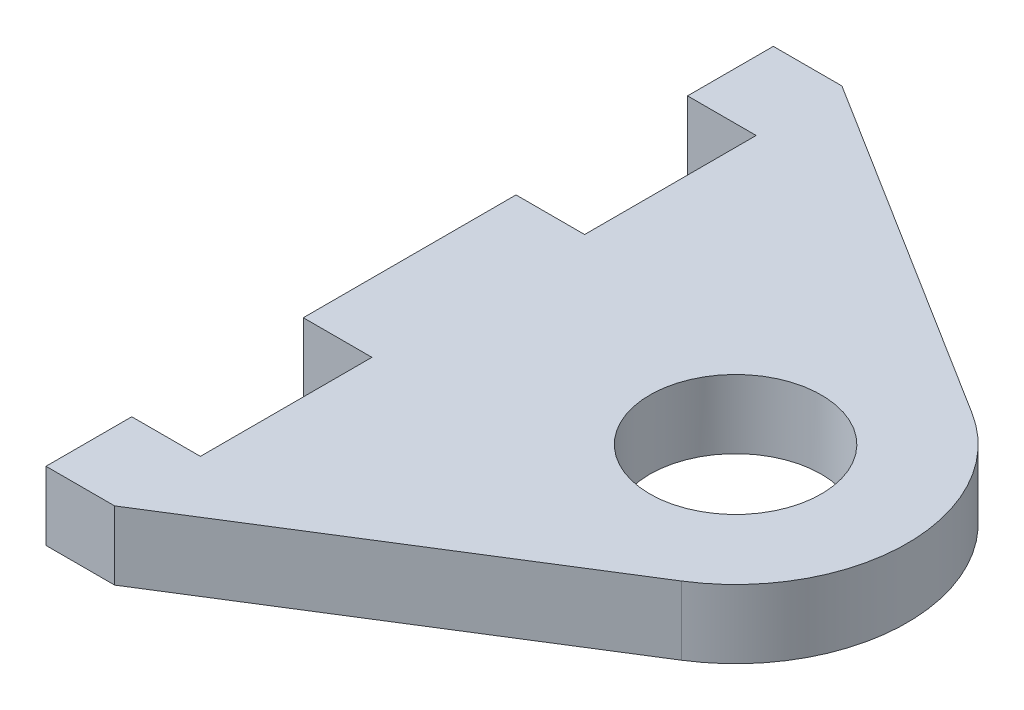
from build123d import *

# Parameters (mm, degrees)
SKETCH1_W               = 20
SKETCH1_H               = 50
BOSS_EXTRUDE2_DEPTH     = 4
CUT_EXTRUDE1_DEPTH      = 2
CUT_EXTRUDE2_DEPTH      = 55
CUT_EXTRUDE2_DEPTH_BACK = 55
SKETCH8_W               = 64.236712081
SKETCH8_H               = 42.4
BOSS_EXTRUDE4_DEPTH     = 4
SKETCH9_R               = 1.7
CUT_EXTRUDE4_DEPTH      = 4
CUT_EXTRUDE5_START      = -4
SKETCH10_R              = 1.7
SKETCH10_W              = 53.236712081
SKETCH10_H              = 42.4
CUT_EXTRUDE5_DEPTH      = 4
SKETCH11_W              = 6
SKETCH11_H              = 42.4
BOSS_EXTRUDE5_DEPTH     = 62.2
SKETCH13_W              = 42.4
SKETCH13_H              = 4
BOSS_EXTRUDE6_DEPTH     = 30
SKETCH14_R              = 5
CUT_EXTRUDE6_DEPTH      = 30
CUT_EXTRUDE7_DEPTH      = 78.888381675
CUT_EXTRUDE7_DEPTH_BACK = 78.888381675
SKETCH15_W              = 2
SKETCH15_H              = 66.2
CUT_EXTRUDE8_DEPTH      = 82.414249367
CUT_EXTRUDE8_DEPTH_BACK = 82.414249367
CUT_EXTRUDE9_DEPTH      = 78.888381675
CUT_EXTRUDE9_DEPTH_BACK = 78.888381675
SKETCH17_W              = 63.590547686
SKETCH17_H              = 84.116810031
SKETCH18_W              = 4
SKETCH18_H              = 10
CUT_EXTRUDE10_DEPTH     = 10


with BuildPart() as part:
    # Sketch1 → Boss-Extrude2 (new body)
    with BuildSketch(Plane(origin=(0, 0, 0), x_dir=(1, 0, 0), z_dir=(0, 1, 0))):
        with Locations((10, 25)):
            Rectangle(SKETCH1_W, SKETCH1_H)
    extrude(amount=BOSS_EXTRUDE2_DEPTH)

    # Sketch3 → Cut-Extrude1 (cut)
    with BuildSketch(Plane(origin=(0, 4, 0), x_dir=(1, 0, 0), z_dir=(0, 1, 0))):
        with BuildLine():
            Line((7.85, 10.95), (6.4, 25))
            Line((6.4, 25), (7.85, 39.05))
            ThreePointArc((7.85, 39.05), (10, 41.2), (12.15, 39.05))
            Line((12.15, 39.05), (13.6, 25))
            Line((13.6, 25), (12.15, 10.95))
            ThreePointArc((12.15, 10.95), (10, 8.8), (7.85, 10.95))
        make_face()
    extrude(amount=-CUT_EXTRUDE1_DEPTH, mode=Mode.SUBTRACT)

    # Sketch7 → Cut-Extrude2 (cut, two sides: drawn at the far end of the back side and taken through both)
    with BuildSketch(Plane(origin=(0, 4, 0), x_dir=(1, 0, 0), z_dir=(0, 1, 0)).offset(-CUT_EXTRUDE2_DEPTH_BACK)):
        with BuildLine():
            Line((17.114068962, 39.76590698), (18.6, 25))
            Line((18.6, 25), (17.114068962, 10.23409302))
            ThreePointArc((17.114068962, 10.23409302), (14.796027788, 5.647112348), (10, 3.8))
            Line((10, 3.8), (0, 3.8))
            Line((0, 3.8), (0, 0))
            Line((0, 0), (20, 0))
            Line((20, 0), (20, 50))
            Line((20, 50), (0, 50))
            Line((0, 50), (0, 46.2))
            Line((0, 46.2), (10, 46.2))
            ThreePointArc((10, 46.2), (14.796027788, 44.352887652), (17.114068962, 39.76590698))
        make_face()
    extrude(amount=CUT_EXTRUDE2_DEPTH + CUT_EXTRUDE2_DEPTH_BACK, mode=Mode.SUBTRACT)

    # Sketch8 → Boss-Extrude4 (add)
    with BuildSketch(Plane.XZ):
        with Locations((-32.118356041, -25)):
            Rectangle(SKETCH8_W, SKETCH8_H)
    extrude(amount=-BOSS_EXTRUDE4_DEPTH)

    # Sketch9 → Cut-Extrude4 (cut)
    with BuildSketch(Plane(origin=(0, 2, 0), x_dir=(1, 0, 0), z_dir=(0, 1, 0))):
        with Locations((10, 25)):
            Circle(SKETCH9_R)
    extrude(amount=-CUT_EXTRUDE4_DEPTH, mode=Mode.SUBTRACT)

    # Sketch10 → Cut-Extrude5 (cut)
    with BuildSketch(Plane.XZ.offset(CUT_EXTRUDE5_START)):
        with Locations((10, -25)):
            Circle(SKETCH10_R)
        with Locations((-37.618356041, -25)):
            Rectangle(SKETCH10_W, SKETCH10_H)
    extrude(amount=CUT_EXTRUDE5_DEPTH, mode=Mode.SUBTRACT)

    # Sketch11 → Boss-Extrude5 (add)
    with BuildSketch(Plane.XZ):
        with Locations((-8, -25)):
            Rectangle(SKETCH11_W, SKETCH11_H)
    extrude(amount=BOSS_EXTRUDE5_DEPTH)

    # Sketch13 → Boss-Extrude6 (add)
    with BuildSketch(Plane(origin=(-5, 0, 0), x_dir=(0, 0, -1), z_dir=(1, 0, 0))):
        with Locations((25, -60.2)):
            Rectangle(SKETCH13_W, SKETCH13_H)
    extrude(amount=BOSS_EXTRUDE6_DEPTH)

    # Sketch14 → Cut-Extrude6 (cut)
    with BuildSketch(Plane(origin=(0, -58.2, 0), x_dir=(1, 0, 0), z_dir=(0, 1, 0))):
        with BuildLine():
            Line((15.30974635, 16.526122865), (-5, 3.8))
            Line((-5, 3.8), (25, 3.8))
            Line((25, 3.8), (25, 46.2))
            Line((25, 46.2), (-5, 46.2))
            Line((-5, 46.2), (15.30974635, 33.473877135))
            ThreePointArc((15.30974635, 33.473877135), (20, 25), (15.30974635, 16.526122865))
        make_face()
        with Locations((10, 25)):
            Circle(SKETCH14_R)
    extrude(amount=-CUT_EXTRUDE6_DEPTH, mode=Mode.SUBTRACT)

    # Sketch15 → Cut-Extrude7 (cut, two sides: drawn at the far end of the back side and taken through both)
    with BuildSketch(Plane.XY.offset(-3.8).offset(-CUT_EXTRUDE7_DEPTH_BACK)):
        with Locations((-10, -29.1)):
            Rectangle(SKETCH15_W, SKETCH15_H)
    extrude(amount=CUT_EXTRUDE7_DEPTH + CUT_EXTRUDE7_DEPTH_BACK, mode=Mode.SUBTRACT)

    # Sketch16 → Cut-Extrude8 (cut, two sides: drawn at the far end of the back side and taken through both)
    with BuildSketch(Plane(origin=(-5, 0, 0), x_dir=(0, 0, -1), z_dir=(1, 0, 0)).offset(-CUT_EXTRUDE8_DEPTH_BACK)):
        Polygon((3.8, 0), (10, -19.1), (20, -19.1), (20, -39.1), (10, -39.1), (3.8, -58.2), align=None)
        Polygon((46.2, -58.2), (40, -39.1), (30, -39.1), (30, -19.1), (40, -19.1), (46.2, 0), align=None)
    extrude(amount=CUT_EXTRUDE8_DEPTH + CUT_EXTRUDE8_DEPTH_BACK, mode=Mode.SUBTRACT)

    # Sketch17 → Cut-Extrude9 (cut, two sides: drawn at the far end of the back side and taken through both)
    with BuildSketch(Plane.XY.offset(-3.8).offset(-CUT_EXTRUDE9_DEPTH_BACK)):
        with Locations((22.795273843, -16.141594985)):
            Rectangle(SKETCH17_W, SKETCH17_H)
    extrude(amount=CUT_EXTRUDE9_DEPTH + CUT_EXTRUDE9_DEPTH_BACK, mode=Mode.SUBTRACT)

    # Sketch18 → Cut-Extrude10 (cut)
    with BuildSketch(Plane(origin=(0, -58.2, 0), x_dir=(1, 0, 0), z_dir=(0, 1, 0))):
        with Locations((-7, 36.2)):
            Rectangle(SKETCH18_W, SKETCH18_H)
        with Locations((-7, 13.8)):
            Rectangle(SKETCH18_W, SKETCH18_H)
    extrude(amount=-CUT_EXTRUDE10_DEPTH, mode=Mode.SUBTRACT)


solid = part.part
